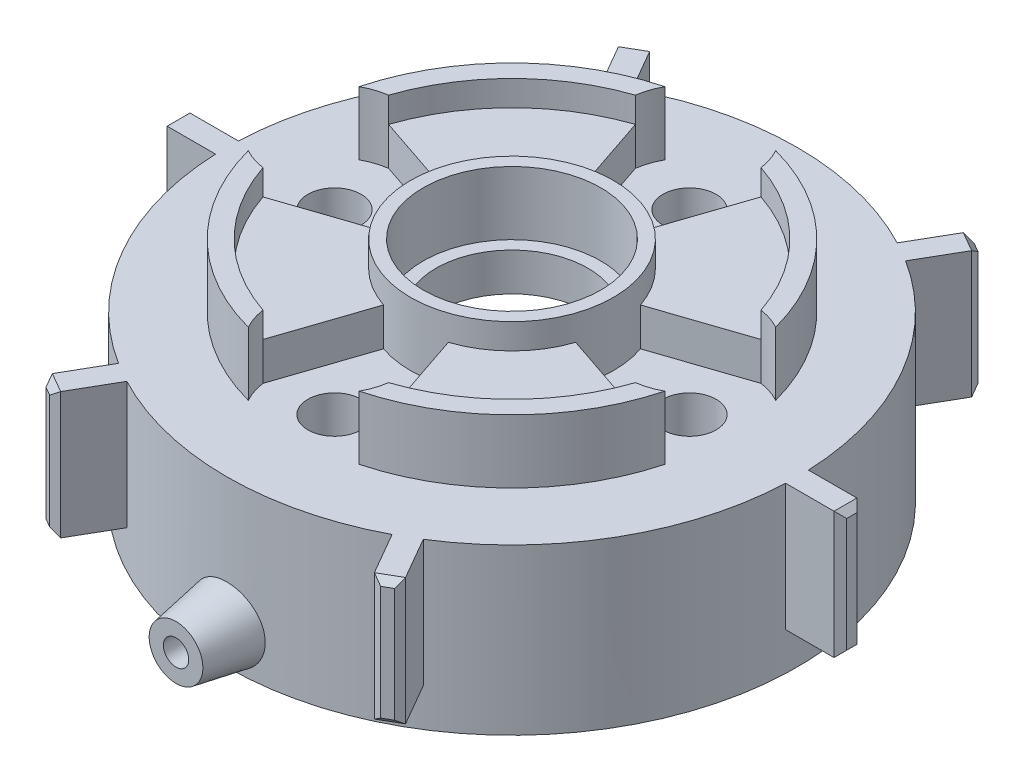
from build123d import *

# Parameters (mm, degrees)
SKETCH_2_R          = 22.5
SKETCH_2_R_2        = 2.1
SKETCH_2_R_3        = 6
EXTRUDE_1_DEPTH     = 3
EXTRUDE_START       = 10
SKETCH_4_R          = 22.5
SKETCH_4_R_2        = 21
EXTRUDE_2_DEPTH     = 10
SKETCH_5_W          = 5.8
SKETCH_5_H          = 1.8
EXTRUDE_3_DEPTH     = 10
SKETCH_6_R          = 8
SKETCH_6_R_2        = 7
EXTRUDE_4_DEPTH     = 5
EXTRUDE_5_DEPTH     = 3
CHAMFER_1_SIZE      = 0.5
EXTRUDE_START_2     = 21.5
SKETCH_9_R          = 3
EXTRUDE_6_DEPTH     = 5
EXTRUDE_6_TAPER     = 10
SKETCH_10_R         = 1
CUT_EXTRUDE_1_DEPTH = 5


with BuildPart() as part:
    # 草图2 → 凸台-拉伸1 (new body)
    with BuildSketch(Plane(origin=(0, 0, 0), x_dir=(1, 0, 0), z_dir=(0, 1, 0))):
        Circle(SKETCH_2_R)
        with Locations((14, 0)):
            Circle(SKETCH_2_R_2, mode=Mode.SUBTRACT)
        with Locations((0, 14)):
            Circle(SKETCH_2_R_2, mode=Mode.SUBTRACT)
        with Locations((0, -14)):
            Circle(SKETCH_2_R_2, mode=Mode.SUBTRACT)
        with Locations((-14, 0)):
            Circle(SKETCH_2_R_2, mode=Mode.SUBTRACT)
        Circle(SKETCH_2_R_3, mode=Mode.SUBTRACT)
    extrude(amount=EXTRUDE_1_DEPTH)

    # 草图4 → 凸台-拉伸2 (add)
    with BuildSketch(Plane.XZ.offset(EXTRUDE_START)):
        Circle(SKETCH_4_R)
        Circle(SKETCH_4_R_2, mode=Mode.SUBTRACT)
    extrude(amount=-EXTRUDE_2_DEPTH)

    # 草图5 → 凸台-拉伸3 (add)
    with BuildSketch(Plane(origin=(0, 3, 0), x_dir=(1, 0, 0), z_dir=(0, 1, 0))):
        with Locations((23.9, 0)):
            Rectangle(SKETCH_5_W, SKETCH_5_H)
        Polygon((12.620577137, -23.659480821), (9.720577137, -18.636533479), (11.279422863, -17.736533479), (14.179422863, -22.759480821), align=None)
        Polygon((-14.179422863, -22.759480821), (-11.279422863, -17.736533479), (-9.720577137, -18.636533479), (-12.620577137, -23.659480821), align=None)
        with Locations((-23.9, 0)):
            Rectangle(SKETCH_5_W, SKETCH_5_H)
        Polygon((-12.620577137, 23.659480821), (-9.720577137, 18.636533479), (-11.279422863, 17.736533479), (-14.179422863, 22.759480821), align=None)
        Polygon((14.179422863, 22.759480821), (11.279422863, 17.736533479), (9.720577137, 18.636533479), (12.620577137, 23.659480821), align=None)
    extrude(amount=-EXTRUDE_3_DEPTH)

    # 草图6 → 凸台-拉伸4 (add)
    # profile 1 of 5: a face of its own
    with BuildSketch(Plane(origin=(0, 3, 0), x_dir=(1, 0, 0), z_dir=(0, 1, 0))):
        Circle(SKETCH_6_R)
        Circle(SKETCH_6_R_2, mode=Mode.SUBTRACT)
    # profile 2 of 5: a face of its own
    with BuildSketch(Plane(origin=(0, 3, 0), x_dir=(1, 0, 0), z_dir=(0, 1, 0))):
        with BuildLine():
            ThreePointArc((16.428571429, 4.370588155), (12.02081528, 12.02081528), (4.370588155, 16.428571429))
            ThreePointArc((4.370588155, 16.428571429), (4.742137366, 15.584971043), (4.952508834, 14.6875))
            ThreePointArc((4.952508834, 14.6875), (10.960155108, 10.960155108), (14.6875, 4.952508834))
            ThreePointArc((14.6875, 4.952508834), (15.584971043, 4.742137366), (16.428571429, 4.370588155))
        make_face()
    # profile 3 of 5: a face of its own
    with BuildSketch(Plane(origin=(0, 3, 0), x_dir=(1, 0, 0), z_dir=(0, 1, 0))):
        with BuildLine():
            ThreePointArc((4.370588155, -16.428571429), (4.742137366, -15.584971043), (4.952508834, -14.6875))
            ThreePointArc((4.952508834, -14.6875), (10.960155108, -10.960155108), (14.6875, -4.952508834))
            ThreePointArc((14.6875, -4.952508834), (15.584971043, -4.742137366), (16.428571429, -4.370588155))
            ThreePointArc((16.428571429, -4.370588155), (12.02081528, -12.02081528), (4.370588155, -16.428571429))
        make_face()
    # profile 4 of 5: a face of its own
    with BuildSketch(Plane(origin=(0, 3, 0), x_dir=(1, 0, 0), z_dir=(0, 1, 0))):
        with BuildLine():
            ThreePointArc((-14.6875, 4.952508834), (-15.584971043, 4.742137366), (-16.428571429, 4.370588155))
            ThreePointArc((-16.428571429, 4.370588155), (-12.02081528, 12.02081528), (-4.370588155, 16.428571429))
            ThreePointArc((-4.370588155, 16.428571429), (-4.742137366, 15.584971043), (-4.952508834, 14.6875))
            ThreePointArc((-4.952508834, 14.6875), (-10.960155108, 10.960155108), (-14.6875, 4.952508834))
        make_face()
    # profile 5 of 5: a face of its own
    with BuildSketch(Plane(origin=(0, 3, 0), x_dir=(1, 0, 0), z_dir=(0, 1, 0))):
        with BuildLine():
            ThreePointArc((-4.952508834, -14.6875), (-4.742137366, -15.584971043), (-4.370588155, -16.428571429))
            ThreePointArc((-4.370588155, -16.428571429), (-12.02081528, -12.02081528), (-16.428571429, -4.370588155))
            ThreePointArc((-16.428571429, -4.370588155), (-15.584971043, -4.742137366), (-14.6875, -4.952508834))
            ThreePointArc((-14.6875, -4.952508834), (-10.960155108, -10.960155108), (-4.952508834, -14.6875))
        make_face()
    extrude(amount=EXTRUDE_4_DEPTH)

    # 草图7 → 凸台-拉伸5 (add)
    with BuildSketch(Plane(origin=(0, 3, 0), x_dir=(1, 0, 0), z_dir=(0, 1, 0))):
        with BuildLine():
            Line((14.6875, -4.952508834), (7.580645161, -2.556133592))
            ThreePointArc((7.580645161, -2.556133592), (5.656854249, -5.656854249), (2.556133592, -7.580645161))
            Line((2.556133592, -7.580645161), (4.952508834, -14.6875))
            ThreePointArc((4.952508834, -14.6875), (10.960155108, -10.960155108), (14.6875, -4.952508834))
        make_face()
        with BuildLine():
            Line((-4.952508834, -14.6875), (-2.556133592, -7.580645161))
            ThreePointArc((-2.556133592, -7.580645161), (-5.656854249, -5.656854249), (-7.580645161, -2.556133592))
            Line((-7.580645161, -2.556133592), (-14.6875, -4.952508834))
            ThreePointArc((-14.6875, -4.952508834), (-10.960155108, -10.960155108), (-4.952508834, -14.6875))
        make_face()
        with BuildLine():
            Line((-14.6875, 4.952508834), (-7.580645161, 2.556133592))
            ThreePointArc((-7.580645161, 2.556133592), (-5.656854249, 5.656854249), (-2.556133592, 7.580645161))
            Line((-2.556133592, 7.580645161), (-4.952508834, 14.6875))
            ThreePointArc((-4.952508834, 14.6875), (-10.960155108, 10.960155108), (-14.6875, 4.952508834))
        make_face()
        with BuildLine():
            Line((4.952508834, 14.6875), (2.556133592, 7.580645161))
            ThreePointArc((2.556133592, 7.580645161), (5.656854249, 5.656854249), (7.580645161, 2.556133592))
            Line((7.580645161, 2.556133592), (14.6875, 4.952508834))
            ThreePointArc((14.6875, 4.952508834), (10.960155108, 10.960155108), (4.952508834, 14.6875))
        make_face()
    extrude(amount=EXTRUDE_5_DEPTH)

    # 倒角1
    chamfer_1_edges = [part.edges().sort_by_distance(p)[0] for p in [
        (-12.620577137, -2, 23.659480821),
        (-13.4, -7, 23.209480821),
        (-14.179422863, -2, 22.759480821),
        (-13.4, 3, 23.209480821),
        (-26.8, -2, 0.9),
        (-26.8, -7, 0),
        (-26.8, -2, -0.9),
        (-26.8, 3, 0),
        (-14.179422863, -2, -22.759480821),
        (-13.4, -7, -23.209480821),
        (-12.620577137, -2, -23.659480821),
        (-13.4, 3, -23.209480821),
        (12.620577137, -2, -23.659480821),
        (13.4, -7, -23.209480821),
        (14.179422863, -2, -22.759480821),
        (13.4, 3, -23.209480821),
        (26.8, -2, -0.9),
        (26.8, -7, 0),
        (26.8, -2, 0.9),
        (26.8, 3, 0),
        (14.179422863, -2, 22.759480821),
        (13.4, -7, 23.209480821),
        (12.620577137, -2, 23.659480821),
        (13.4, 3, 23.209480821),
    ]]
    chamfer(chamfer_1_edges, length=CHAMFER_1_SIZE)

    # 草图9 → 凸台-拉伸6 (add)
    with BuildSketch(Plane.XY.offset(EXTRUDE_START_2)):
        with Locations((0, -7)):
            Circle(SKETCH_9_R)
    extrude(amount=EXTRUDE_6_DEPTH, taper=EXTRUDE_6_TAPER)

    # 草图10 → 切除-拉伸1 (cut)
    with BuildSketch(Plane.XY.offset(26.5)):
        with Locations((0, -7)):
            Circle(SKETCH_10_R)
    extrude(amount=-CUT_EXTRUDE_1_DEPTH, mode=Mode.SUBTRACT)


solid = part.part
